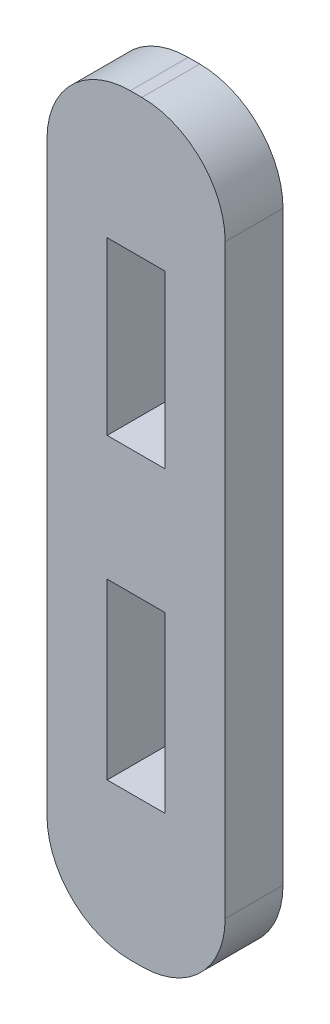
from build123d import *

# Parameters (mm, degrees)
SKETCH1_W           = 4.8895
SKETCH1_H           = 20.659220476
BOSS_EXTRUDE1_DEPTH = 1.5875
CUT_EXTRUDE1_DEPTH  = 22.289216922
FILLET1_R           = 2.286


with BuildPart() as part:
    # Sketch1 → Boss-Extrude1 (new body)
    with BuildSketch(Plane.XY):
        with Locations((2.44475, 10.329610238)):
            Rectangle(SKETCH1_W, SKETCH1_H)
    extrude(amount=BOSS_EXTRUDE1_DEPTH)

    # Sketch2 → Cut-Extrude1 (cut, through all)
    with BuildSketch(Plane(origin=(0, 0, 0), x_dir=(-1, 0, 0), z_dir=(0, 0, -1))):
        Polygon((-3.2385, 14.309213693), (-3.2385, 12.150213693), (-1.651, 12.150213693), (-1.651, 14.309213693), (-1.651, 15.465398827), (-1.651, 15.792673193), (-1.651, 16.849213693), (-3.2385, 16.849213693), (-3.2385, 15.792673193), (-3.2385, 15.465398827), align=None)
        Polygon((-1.651, 5.23175416), (-1.651, 6.423466465), (-1.651, 8.734196509), (-3.2385, 8.734196509), (-3.2385, 6.423466465), (-3.2385, 5.23175416), (-3.2385, 4.866547283), (-3.2385, 3.961736827), (-1.651, 3.961736827), (-1.651, 4.866547283), align=None)
    extrude(amount=-CUT_EXTRUDE1_DEPTH, mode=Mode.SUBTRACT)

    # Fillet1
    fillet1_edges = [part.edges().sort_by_distance(p)[0] for p in [
        (0, 0, 0.79375),
        (4.8895, 0, 0.79375),
        (4.8895, 20.659220476, 0.79375),
        (0, 20.659220476, 0.79375),
    ]]
    fillet(fillet1_edges, radius=FILLET1_R)


solid = part.part
